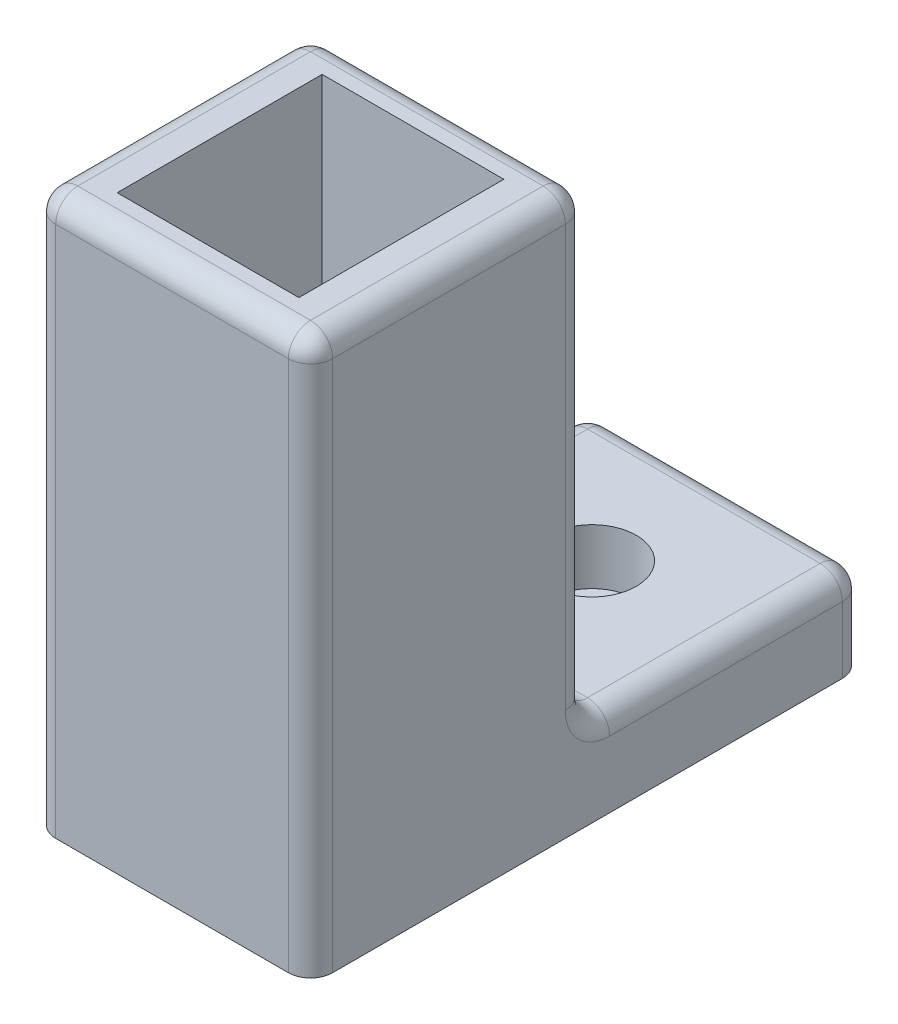
from build123d import *

# Parameters (mm, degrees)
SKETCH1_W               = 25
SKETCH1_H               = 25
SKETCH1_W_2             = 16.4
SKETCH1_H_2             = 18.5
BOSS_EXTRUDE1_DEPTH     = 50
SKETCH6_W               = 25
SKETCH6_H               = 50
BOSS_EXTRUDE3_DEPTH     = 8
FILLET2_R               = 2
SKETCH7_R               = 4
CUT_EXTRUDE1_DEPTH      = 5
CUT_EXTRUDE4_DEPTH      = 64.73774392
CUT_EXTRUDE4_DEPTH_BACK = 64.73774392
SKETCH8_R               = 2.38125


with BuildPart() as part:
    # Sketch1 → Boss-Extrude1 (new body)
    with BuildSketch(Plane(origin=(0, 0, 0), x_dir=(1, 0, 0), z_dir=(0, 1, 0))):
        Rectangle(SKETCH1_W, SKETCH1_H)
        Rectangle(SKETCH1_W_2, SKETCH1_H_2, mode=Mode.SUBTRACT)
    extrude(amount=BOSS_EXTRUDE1_DEPTH)

    # Sketch6 → Boss-Extrude3 (add)
    with BuildSketch(Plane(origin=(0, 0, 0), x_dir=(1, 0, 0), z_dir=(0, 1, 0))):
        with Locations((0, 12.5)):
            Rectangle(SKETCH6_W, SKETCH6_H)
    extrude(amount=BOSS_EXTRUDE3_DEPTH)

    # Fillet2
    fillet2_edges = [part.edges().sort_by_distance(p)[0] for p in [
        (12.5, 4, -37.5),
        (-12.5, 4, -37.5),
        (-12.5, 8, -25),
        (0, 8, -37.5),
        (12.5, 8, -25),
        (0, 8, -12.5),
        (0, 50, -12.5),
        (12.5, 29, -12.5),
        (12.5, 50, 0),
        (12.5, 25, 12.5),
        (-12.5, 25, 12.5),
        (0, 50, 12.5),
        (-12.5, 29, -12.5),
        (-12.5, 50, 0),
    ]]
    fillet(fillet2_edges, radius=FILLET2_R)

    # Sketch7 → Cut-Extrude1 (cut)
    with BuildSketch(Plane(origin=(0, 8, 0), x_dir=(1, 0, 0), z_dir=(0, 1, 0))):
        Circle(SKETCH7_R)
        with Locations((0, 25.4)):
            Circle(SKETCH7_R)
    extrude(amount=-CUT_EXTRUDE1_DEPTH, mode=Mode.SUBTRACT)

    # Sketch8 → Cut-Extrude4 (cut, two sides: drawn at the far end of the back side and taken through both)
    with BuildSketch(Plane(origin=(0, 0, 0), x_dir=(1, 0, 0), z_dir=(0, 1, 0)).offset(-CUT_EXTRUDE4_DEPTH_BACK)):
        Circle(SKETCH8_R)
        with Locations((0, 25.4)):
            Circle(SKETCH8_R)
    extrude(amount=CUT_EXTRUDE4_DEPTH + CUT_EXTRUDE4_DEPTH_BACK, mode=Mode.SUBTRACT)


solid = part.part
